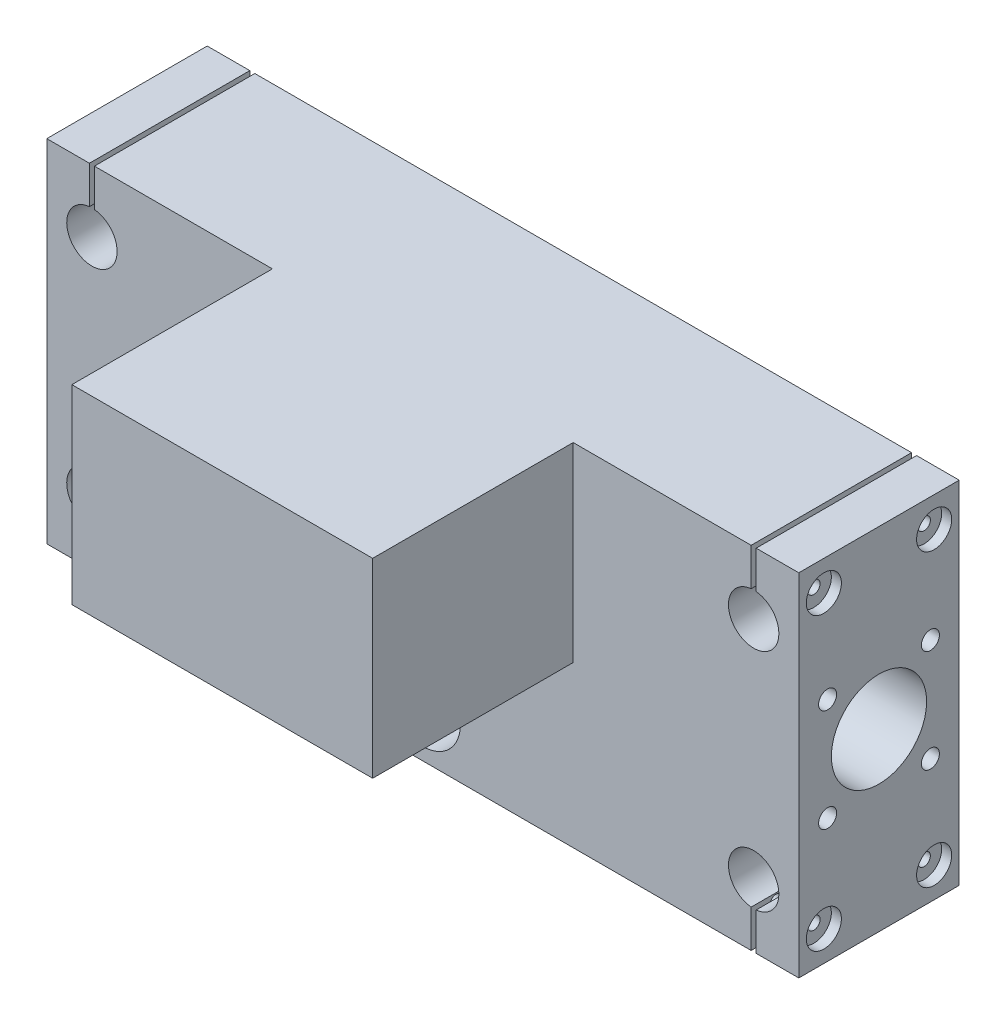
from build123d import *

# Parameters (mm, degrees)
SKETCH1_W                      = 150
SKETCH1_H                      = 70
BOSS_EXTRUDE1_DEPTH            = 32
SKETCH2_R                      = 9.5
LINEAR_BEARING_CUT_1_DEPTH     = 55
Y_AXIS_SHAFTS_CUT_DEPTH        = 169.594187326
LINEAR_BEARING_CUT_2_START     = -55
SKETCH7_R                      = 9.5
LINEAR_BEARING_CUT_2_DEPTH     = 55
SKETCH6_R                      = 6
BETWEEN_BEARINGS_DEPTH         = 123.266103234
SKETCH8_R                      = 3.5
SHAFT_HOLDER_SCREW_CUT_DEPTH   = 4
SKETCH9_R                      = 1.25
SHAFT_HOLDER_SCREW_CUT2_DEPTH  = 20
SHAFT_HOLDER_SCREW_CUT_3_START = -2
SKETCH10_R                     = 3.5
SHAFT_HOLDER_SCREW_CUT_3_DEPTH = 2
SHAFT_HOLDER_SCREW_CUT_4_START = -20
SKETCH11_R                     = 1.25
SHAFT_HOLDER_SCREW_CUT_4_DEPTH = 20
SKETCH12_R                     = 1.8
LINEAR_BEARING_SREW1_DEPTH     = 14
SKETCH13_R                     = 1.85
LINEAR_BEARING_SCREW2_DEPTH    = 14
SKETCH14_R                     = 7.5
CUT_EXTRUDE1_DEPTH             = 169.594187326
SKETCH16_W                     = 60
SKETCH16_H                     = 38
BOSS_EXTRUDE3_DEPTH            = 40


with BuildPart() as part:
    # Sketch1 → Boss-Extrude1 (new body)
    with BuildSketch(Plane.XY):
        with Locations((-75, -35)):
            Rectangle(SKETCH1_W, SKETCH1_H)
    extrude(amount=BOSS_EXTRUDE1_DEPTH)

    # Sketch2 → Linear_bearing-cut-1 (cut)
    with BuildSketch(Plane.ZY.offset(150)):
        with Locations((16, -35)):
            Circle(SKETCH2_R)
    extrude(amount=-LINEAR_BEARING_CUT_1_DEPTH, mode=Mode.SUBTRACT)

    # Sketch5 → Y-axis-shafts-cut (cut, through all)
    with BuildSketch(Plane.XY.offset(32)):
        with BuildLine():
            Line((-141.5, 0), (-141.5, -7.5))
            ThreePointArc((-141.5, -7.5), (-141, -17.524937811), (-140.5, -7.5))
            Line((-140.5, -7.5), (-140.5, 0))
            Line((-140.5, 0), (-141.5, 0))
        make_face()
        with BuildLine():
            Line((-8.5, 0), (-8.5, -7.5))
            ThreePointArc((-8.5, -7.5), (-9, -17.524937811), (-9.5, -7.5))
            Line((-9.5, -7.5), (-9.5, 0))
            Line((-9.5, 0), (-8.5, 0))
        make_face()
        with BuildLine():
            Line((-141.5, -70), (-141.5, -62.5))
            ThreePointArc((-141.5, -62.5), (-141, -52.475062189), (-140.5, -62.5))
            Line((-140.5, -62.5), (-140.5, -70))
            Line((-140.5, -70), (-141.5, -70))
        make_face()
        with BuildLine():
            Line((-9.5, -70), (-9.5, -62.5))
            ThreePointArc((-9.5, -62.5), (-9, -52.475062189), (-8.5, -62.5))
            Line((-8.5, -62.5), (-8.5, -70))
            Line((-8.5, -70), (-9.5, -70))
        make_face()
    extrude(amount=-Y_AXIS_SHAFTS_CUT_DEPTH, mode=Mode.SUBTRACT)

    # Sketch7 → Linear-bearing-cut-2 (cut)
    with BuildSketch(Plane(origin=(0, 0, 0), x_dir=(0, 0, -1), z_dir=(1, 0, 0)).offset(LINEAR_BEARING_CUT_2_START)):
        with Locations((-16, -35)):
            Circle(SKETCH7_R)
    extrude(amount=LINEAR_BEARING_CUT_2_DEPTH, mode=Mode.SUBTRACT)

    # Sketch6 → between-bearings (cut, through all)
    with BuildSketch(Plane.ZY.offset(95)):
        with Locations((16, -35)):
            Circle(SKETCH6_R)
    extrude(amount=-BETWEEN_BEARINGS_DEPTH, mode=Mode.SUBTRACT)

    # Sketch8 → shaft-holder-screw-cut (cut)
    with BuildSketch(Plane.ZY.offset(150)):
        with Locations((5, -6)):
            Circle(SKETCH8_R)
        with Locations((27, -6)):
            Circle(SKETCH8_R)
        with Locations((27, -64)):
            Circle(SKETCH8_R)
        with Locations((5, -64)):
            Circle(SKETCH8_R)
    extrude(amount=-SHAFT_HOLDER_SCREW_CUT_DEPTH, mode=Mode.SUBTRACT)

    # Sketch9 → shaft-holder-screw-cut2 (cut)
    with BuildSketch(Plane.ZY.offset(146)):
        with Locations((5, -6)):
            Circle(SKETCH9_R)
        with Locations((27, -6)):
            Circle(SKETCH9_R)
        with Locations((5, -64)):
            Circle(SKETCH9_R)
        with Locations((27, -64)):
            Circle(SKETCH9_R)
    extrude(amount=-SHAFT_HOLDER_SCREW_CUT2_DEPTH, mode=Mode.SUBTRACT)

    # Sketch10 → shaft-holder-screw-cut-3 (cut)
    with BuildSketch(Plane(origin=(0, 0, 0), x_dir=(0, 0, -1), z_dir=(1, 0, 0)).offset(SHAFT_HOLDER_SCREW_CUT_3_START)):
        with Locations((-27, -6)):
            Circle(SKETCH10_R)
        with Locations((-5, -6)):
            Circle(SKETCH10_R)
        with Locations((-5, -64)):
            Circle(SKETCH10_R)
        with Locations((-27, -64)):
            Circle(SKETCH10_R)
    extrude(amount=SHAFT_HOLDER_SCREW_CUT_3_DEPTH, mode=Mode.SUBTRACT)

    # Sketch11 → shaft-holder-screw-cut-4 (cut)
    with BuildSketch(Plane(origin=(-2, 0, 0), x_dir=(0, 0, -1), z_dir=(1, 0, 0)).offset(SHAFT_HOLDER_SCREW_CUT_4_START)):
        with Locations((-27, -6)):
            Circle(SKETCH11_R)
        with Locations((-5, -6)):
            Circle(SKETCH11_R)
        with Locations((-5, -64)):
            Circle(SKETCH11_R)
        with Locations((-27, -64)):
            Circle(SKETCH11_R)
    extrude(amount=SHAFT_HOLDER_SCREW_CUT_4_DEPTH, mode=Mode.SUBTRACT)

    # Sketch12 → Linear-bearing-srew1 (cut)
    with BuildSketch(Plane(origin=(0, 0, 0), x_dir=(0, 0, -1), z_dir=(1, 0, 0))):
        with Locations((-5.75, -24.75)):
            Circle(SKETCH12_R)
        with Locations((-26.25, -24.75)):
            Circle(SKETCH12_R)
        with Locations((-5.75, -45.25)):
            Circle(SKETCH12_R)
        with Locations((-26.25, -45.25)):
            Circle(SKETCH12_R)
    extrude(amount=-LINEAR_BEARING_SREW1_DEPTH, mode=Mode.SUBTRACT)

    # Sketch13 → Linear-bearing-screw2 (cut)
    with BuildSketch(Plane.ZY.offset(150)):
        with Locations((27.5, -24.75)):
            Circle(SKETCH13_R)
        with Locations((4.5, -24.75)):
            Circle(SKETCH13_R)
        with Locations((27.5, -45.25)):
            Circle(SKETCH13_R)
        with Locations((4.5, -45.25)):
            Circle(SKETCH13_R)
    extrude(amount=-LINEAR_BEARING_SCREW2_DEPTH, mode=Mode.SUBTRACT)

    # Sketch14 → Cut-Extrude1 (cut, through all)
    with BuildSketch(Plane.XY.offset(32)):
        with Locations((-75, -60)):
            Circle(SKETCH14_R)
    extrude(amount=-CUT_EXTRUDE1_DEPTH, mode=Mode.SUBTRACT)

    # Sketch16 → Boss-Extrude3 (add)
    with BuildSketch(Plane.XY.offset(32)):
        with Locations((-75, -19)):
            Rectangle(SKETCH16_W, SKETCH16_H)
    extrude(amount=BOSS_EXTRUDE3_DEPTH)


solid = part.part
